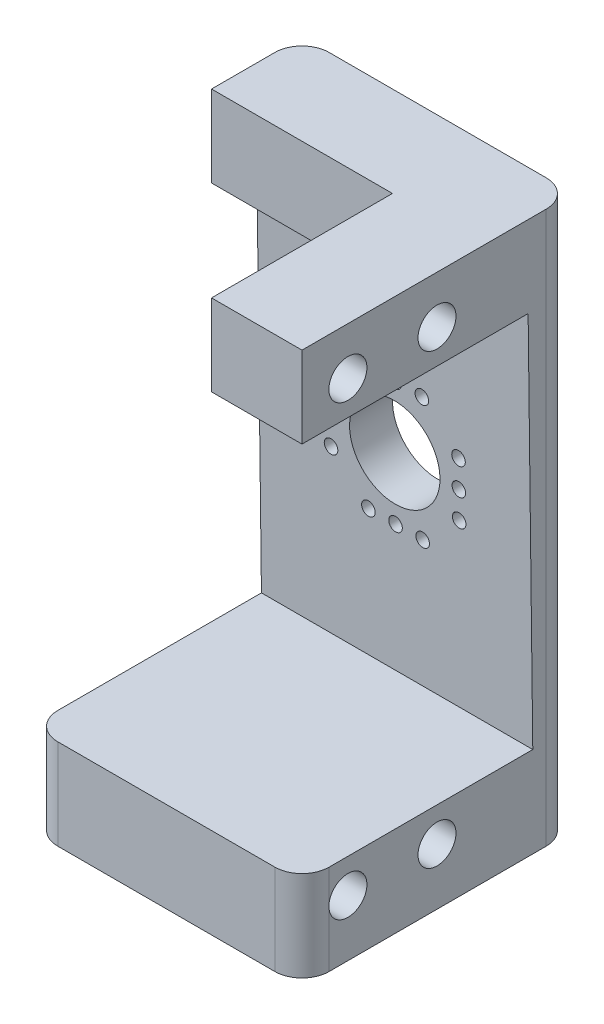
from build123d import *

# Parameters (mm, degrees)
SKETCH_1_W          = 44.75
SKETCH_1_H          = 50
EXTRUDE_1_DEPTH     = 30
SHELL_1_T           = 5
FILLET_1_R          = 5
SKETCH_2_R          = 0.75
CUT_EXTRUDE_1_DEPTH = 70.264438928
SKETCH_3_R          = 5
CUT_EXTRUDE_2_DEPTH = 70.264438928
EXTRUDE_2_DEPTH     = 30
CUT_EXTRUDE_3_DEPTH = 20
SKETCH_7_R          = 2.1
CUT_EXTRUDE_4_DEPTH = 159.731347329
SKETCH_8_W          = 18
SKETCH_8_H          = 45
CUT_EXTRUDE_5_DEPTH = 10
SKETCH_9_W          = 18
SKETCH_9_H          = 45
CUT_EXTRUDE_6_DEPTH = 10
FILLET_2_R          = 3
SKETCH_10_W         = 85.567589514
SKETCH_10_H         = 51.13951385
CUT_EXTRUDE_7_DEPTH = 122.018141743
CUT_EXTRUDE_8_DEPTH = 156.88457272
SKETCH_12_R         = 5
SKETCH_12_R_2       = 0.75
CUT_EXTRUDE_9_DEPTH = 154.138857117


with BuildPart() as part:
    # 草图1 → 凸台-拉伸1 (new body)
    with BuildSketch(Plane.XY):
        Rectangle(SKETCH_1_W, SKETCH_1_H)
    extrude(amount=EXTRUDE_1_DEPTH)

    # 抽壳1
    shell_1_openings = [part.faces().sort_by_distance(p)[0] for p in [
        (0, -25, 15),
        (0, 0, 0),
        (0, 0, 30),
    ]]
    offset(amount=SHELL_1_T, openings=shell_1_openings, kind=Kind.INTERSECTION)

    # 圆角1
    # the kernel refuses this fillet: 5 mm, written as the material it takes off along each edge
    with BuildSketch(Plane(origin=(-27.375, 30, -12.5), x_dir=(1, 0, 0), z_dir=(0, 0, 1)), Plane(origin=(-27.375, -25, 42.5), x_dir=(1, 0, 0), z_dir=(0, 0, -1)), Plane(origin=(27.375, -25, -12.5), x_dir=(-1, 0, 0), z_dir=(0, 0, 1)), Plane(origin=(27.375, 30, 42.5), x_dir=(-1, 0, 0), z_dir=(0, 0, -1))) as fillet_1_piece_1:
        with BuildLine():
            CenterArc((FILLET_1_R, -FILLET_1_R), FILLET_1_R, 90, 90)
            Line((0, -FILLET_1_R), (0, 0))
            Line((0, 0), (FILLET_1_R, 0))
        make_face()
    extrude(amount=55, mode=Mode.SUBTRACT)
    with BuildSketch(Plane(origin=(-27.375, -37.5, 30), x_dir=(1, 0, 0), z_dir=(0, 1, 0)), Plane(origin=(27.375, 42.5, 30), x_dir=(-1, 0, 0), z_dir=(0, -1, 0))) as fillet_1_piece_2:
        with BuildLine():
            CenterArc((FILLET_1_R, FILLET_1_R), FILLET_1_R, 180, 90)
            Line((0, FILLET_1_R), (0, 0))
            Line((0, 0), (FILLET_1_R, 0))
        make_face()
    extrude(amount=80, mode=Mode.SUBTRACT)
    with BuildSketch(Plane(origin=(-27.375, -37.5, 0), x_dir=(1, 0, 0), z_dir=(0, 1, 0)), Plane(origin=(27.375, 42.5, 0), x_dir=(-1, 0, 0), z_dir=(0, -1, 0))) as fillet_1_piece_3:
        with BuildLine():
            CenterArc((FILLET_1_R, -FILLET_1_R), FILLET_1_R, 90, 90)
            Line((0, -FILLET_1_R), (0, 0))
            Line((0, 0), (FILLET_1_R, 0))
        make_face()
    extrude(amount=80, mode=Mode.SUBTRACT)

    # 草图2 → 切除-拉伸1 (cut, through all)
    with BuildSketch(Plane.ZY.offset(27.375)):
        with Locations(Location((15, 7, 0), (0, 0, 270))):
            Circle(SKETCH_2_R)
        with Locations(Location((12, 7, 0), (0, 0, 270))):
            Circle(SKETCH_2_R)
        with Locations(Location((18, 7, 0), (0, 0, 270))):
            Circle(SKETCH_2_R)
        with Locations(Location((8, -3, 0), (0, 0, 90))):
            Circle(SKETCH_2_R)
        with Locations(Location((8, 0, 0), (0, 0, 90))):
            Circle(SKETCH_2_R)
        with Locations(Location((8, 3, 0), (0, 0, 90))):
            Circle(SKETCH_2_R)
        with Locations(Location((12, -7, 0), (0, 0, 90))):
            Circle(SKETCH_2_R)
        with Locations(Location((15, -7, 0), (0, 0, 90))):
            Circle(SKETCH_2_R)
        with Locations(Location((18, -7, 0), (0, 0, 90))):
            Circle(SKETCH_2_R)
        with Locations(Location((22, -3, 0), (0, 0, 270))):
            Circle(SKETCH_2_R)
        with Locations(Location((22, 0, 0), (0, 0, 270))):
            Circle(SKETCH_2_R)
        with Locations(Location((22, 3, 0), (0, 0, 270))):
            Circle(SKETCH_2_R)
    extrude(amount=-CUT_EXTRUDE_1_DEPTH, mode=Mode.SUBTRACT)

    # 草图3 → 切除-拉伸2 (cut, through all)
    with BuildSketch(Plane(origin=(27.375, 0, 0), x_dir=(0, 0, -1), z_dir=(1, 0, 0))):
        with Locations(Location((-15, 0, 0), (0, 0, 90))):
            Circle(SKETCH_3_R)
    extrude(amount=-CUT_EXTRUDE_2_DEPTH, mode=Mode.SUBTRACT)

    # 草图4 → 凸台-拉伸2 (add)
    with BuildSketch(Plane.XY.offset(30)):
        Polygon((0, 30), (-15, 30), (-15, 150), (15, 150), (15, 30), align=None)
    extrude(amount=-EXTRUDE_2_DEPTH)

    # 草图6 → 切除-拉伸3 (cut)
    with BuildSketch(Plane.XY.offset(30)):
        Polygon((-15, 99), (15, 99), (15, 141), (5, 141), (5, 150), (-15, 150), (-15, 141), align=None)
    extrude(amount=-CUT_EXTRUDE_3_DEPTH, mode=Mode.SUBTRACT)

    # 草图7 → 切除-拉伸4 (cut, through all)
    with BuildSketch(Plane(origin=(15, 0, 0), x_dir=(0, 0, -1), z_dir=(1, 0, 0))):
        with Locations((-24.925, 144.75)):
            Circle(SKETCH_7_R)
        with Locations((-15.075, 144.75)):
            Circle(SKETCH_7_R)
        with Locations(Location((-15.075, 95.25, 0), (0, 0, 180))):
            Circle(SKETCH_7_R)
        with Locations(Location((-24.925, 95.25, 0), (0, 0, 180))):
            Circle(SKETCH_7_R)
    extrude(amount=-CUT_EXTRUDE_4_DEPTH, mode=Mode.SUBTRACT)

    # 草图8 → 切除-拉伸5 (cut)
    with BuildSketch(Plane.XY.offset(30)):
        with Locations((0, 64.5)):
            Rectangle(SKETCH_8_W, SKETCH_8_H)
    extrude(amount=-CUT_EXTRUDE_5_DEPTH, mode=Mode.SUBTRACT)

    # 草图9 → 切除-拉伸6 (cut)
    with BuildSketch(Plane(origin=(0, 0, 0), x_dir=(-1, 0, 0), z_dir=(0, 0, -1))):
        with Locations((0, 65)):
            Rectangle(SKETCH_9_W, SKETCH_9_H)
    extrude(amount=-CUT_EXTRUDE_6_DEPTH, mode=Mode.SUBTRACT)

    # 圆角2
    fillet_2_edges = [part.edges().sort_by_distance(p)[0] for p in [
        (-15, 90, 0),
        (15, 90, 0),
        (15, 64.5, 30),
        (-15, 64.5, 30),
    ]]
    fillet(fillet_2_edges, radius=FILLET_2_R)

    # 草图10 → 切除-拉伸7 (cut, through all)
    with BuildSketch(Plane(origin=(0, 89, 0), x_dir=(1, 0, 0), z_dir=(0, 1, 0))):
        with Locations((0, -19.677859547)):
            Rectangle(SKETCH_10_W, SKETCH_10_H)
    extrude(amount=-CUT_EXTRUDE_7_DEPTH, mode=Mode.SUBTRACT)

    # 草图11 → 切除-拉伸8 (cut, through all)
    with BuildSketch(Plane(origin=(15, 0, 0), x_dir=(0, 0, -1), z_dir=(1, 0, 0))):
        Polygon((-10, 99), (-10, 141), (-5, 141), (-4.484921434, 99), align=None)
    extrude(amount=-CUT_EXTRUDE_8_DEPTH, mode=Mode.SUBTRACT)

    # 草图12 → 切除-拉伸9 (cut, through all)
    with BuildSketch(Plane(origin=(0, -0.040106419, 3.270315816), x_dir=(1, 0, 0), z_dir=(0, -0.012262853244216906, 0.9999248083882663))):
        with Locations(Location((0, 120.133486449, 0), (0, 0, 270))):
            Circle(SKETCH_12_R)
        with Locations(Location((7.084353343, 120.133486449, 0), (0, 0, 270))):
            Circle(SKETCH_12_R_2)
        with Locations(Location((7.084353343, 117.133486449, 0), (0, 0, 270))):
            Circle(SKETCH_12_R_2)
        with Locations(Location((3.077588855, 127.014955444, 0), (0, 0, 270))):
            Circle(SKETCH_12_R_2)
        with Locations(Location((-2.922031664, 127.082435984, 0), (0, 0, 270))):
            Circle(SKETCH_12_R_2)
        with Locations(Location((-7.084353343, 123.133486449, 0), (0, 0, 270))):
            Circle(SKETCH_12_R_2)
        with Locations(Location((-7.084353343, 117.133486449, 0), (0, 0, 270))):
            Circle(SKETCH_12_R_2)
        with Locations(Location((-3, 113.217839792, 0), (0, 0, 270))):
            Circle(SKETCH_12_R_2)
        with Locations(Location((0, 113.217839792, 0), (0, 0, 270))):
            Circle(SKETCH_12_R_2)
        with Locations(Location((3, 113.217839792, 0), (0, 0, 270))):
            Circle(SKETCH_12_R_2)
        with Locations(Location((7.084353343, 123.133486449, 0), (0, 0, 270))):
            Circle(SKETCH_12_R_2)
        with Locations(Location((0.077778595, 127.048695714, 0), (0, 0, 270))):
            Circle(SKETCH_12_R_2)
        with Locations(Location((-7.084353343, 120.133486449, 0), (0, 0, 270))):
            Circle(SKETCH_12_R_2)
    extrude(amount=-CUT_EXTRUDE_9_DEPTH, mode=Mode.SUBTRACT)


solid = part.part
